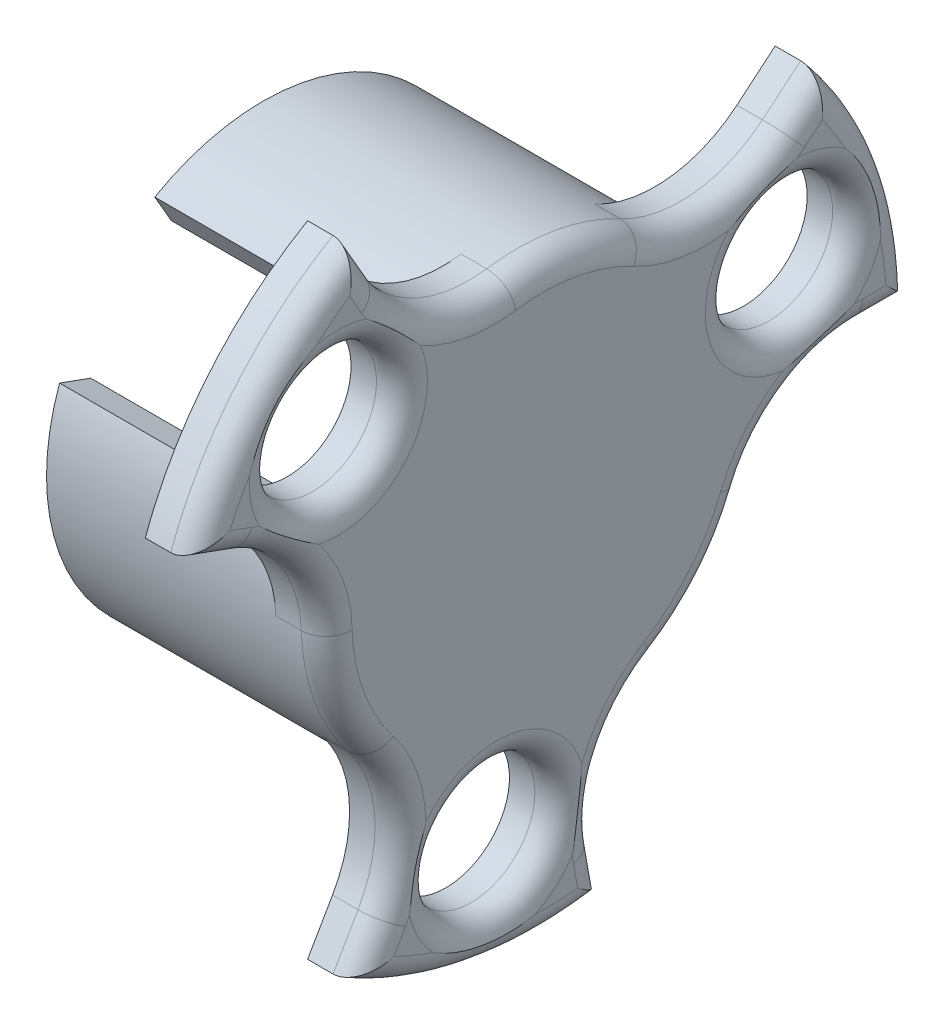
from build123d import *

# Parameters (mm, degrees)
SKETCH1_R           = 8.5
BOSS_EXTRUDE1_DEPTH = 1
SKETCH2_R           = 5.375
BOSS_EXTRUDE2_DEPTH = 1.5
BOSS_EXTRUDE2_TAPER = 40.000000000000085
BOSS_EXTRUDE3_START = 10
SKETCH3_R           = 8.5
SKETCH3_R_2         = 7.200000000000001
BOSS_EXTRUDE3_DEPTH = 10
CUT_REVOLVE1_ANGLE  = 40.000000000000085
CIRPATTERN1_COUNT   = 3
REVOLVE1_ANGLE      = 40.000000000000085
SKETCH9_R           = 2.5000000000000004
CUT_EXTRUDE1_DEPTH  = 10
CIRPATTERN3_COUNT   = 3
FILLET3_R           = 5
FILLET4_R           = 1


with BuildPart() as part:
    # Sketch1 → Boss-Extrude1 (new body)
    with BuildSketch(Plane(origin=(0, 0, 0), x_dir=(0, 0, -1), z_dir=(1, 0, 0))):
        Circle(SKETCH1_R)
    extrude(amount=BOSS_EXTRUDE1_DEPTH)

    # Sketch2 → Boss-Extrude2 (add)
    with BuildSketch(Plane.ZY):
        Circle(SKETCH2_R)
    extrude(amount=BOSS_EXTRUDE2_DEPTH, taper=BOSS_EXTRUDE2_TAPER)

    # Sketch3 → Boss-Extrude3 (add)
    with BuildSketch(Plane.ZY.offset(BOSS_EXTRUDE3_START)):
        Circle(SKETCH3_R)
        Circle(SKETCH3_R_2, mode=Mode.SUBTRACT)
    extrude(amount=-BOSS_EXTRUDE3_DEPTH)

    # Sketch6 → Cut-Revolve1 (revolve, cut)
    with BuildSketch(Plane(origin=(0, 0, 0), x_dir=(1, 0, 0), z_dir=(0, 1, 0))):
        Polygon((-9.999999999999998, 8.5), (-10, 7.200000000000001), (-0.9999999999999991, 7.200000000000001), (-0.9999999999999991, 8.5), align=None)
    cut_revolve1 = revolve(axis=Axis((-10, 0, 0), (1, 0, 0)), revolution_arc=CUT_REVOLVE1_ANGLE, mode=Mode.SUBTRACT)

    # CirPattern1: Cut-Revolve1 ×3 about axis
    cirpattern1_axis = Axis((0, 0, 0), (1, 0, 0))
    for i in range(1, CIRPATTERN1_COUNT):
        add(cut_revolve1.rotate(cirpattern1_axis, i * 360 / CIRPATTERN1_COUNT), mode=Mode.SUBTRACT)

    # Sketch8 → Revolve1 (revolve)
    with BuildSketch(Plane(origin=(0, 0, 0), x_dir=(1, 0, 0), z_dir=(0, 1, 0))):
        Polygon((-0.9999999999999996, 8.5), (1, 8.5), (0.9999999999999996, 14.5), (-0.9999999999999996, 14.5), align=None)
    revolve1 = revolve(axis=Axis((-10, 0, 0), (1, 0, 0)), revolution_arc=REVOLVE1_ANGLE)

    # Sketch9 → Cut-Extrude1 (cut)
    with BuildSketch(Plane.ZY.offset(0.9999999999999991)):
        with Locations((-9.866772518252038, 3.5912115049195292)):
            Circle(SKETCH9_R)
    cut_extrude1 = extrude(amount=-CUT_EXTRUDE1_DEPTH, mode=Mode.SUBTRACT)

    # CirPattern3: Revolve1, Cut-Extrude1 ×3 about axis
    cirpattern3_axis = Axis((0, -1.1e-16, 1.8e-16), (1, 0, 0))
    add([revolve1.rotate(cirpattern3_axis, i * 360 / CIRPATTERN3_COUNT) for i in range(1, CIRPATTERN3_COUNT)])
    add([cut_extrude1.rotate(cirpattern3_axis, i * 360 / CIRPATTERN3_COUNT) for i in range(1, CIRPATTERN3_COUNT)], mode=Mode.SUBTRACT)

    # Fillet3
    fillet3_edges = [part.edges().sort_by_distance(p)[0] for p in [
        (4.4e-16, 0, -8.5),
        (4.4e-16, 5.463694682335594, -6.511377766511305),
        (2.2e-16, -7.361215932167726, 4.2500000000000036),
        (2.2e-16, -8.370865900603766, -1.4760095101689152),
        (2.2e-16, 7.361215932167729, 4.249999999999998),
        (2.2e-16, 2.907171218268174, 7.987387276680224),
    ]]
    fillet(fillet3_edges, radius=FILLET3_R)

    # Fillet4
    # the kernel refuses this fillet: 1 mm, written as the material it takes off along each edge
    with BuildSketch(Plane(origin=(1, -10.340481406628186, 1.8233058655027679), x_dir=(0, 0.8660254037844382, -0.5000000000000006), z_dir=(0, 0.5000000000000006, 0.8660254037844382))) as fillet4_piece_1:
        with BuildLine():
            CenterArc((2.4999999999999996 + FILLET4_R, FILLET4_R), FILLET4_R, 180, 90)
            Line((2.4999999999999996, FILLET4_R), (2.4999999999999996, 0))
            Line((2.4999999999999996, 0), (2.4999999999999996 + FILLET4_R, 0))
        make_face()
    revolve(axis=Axis((1, -10.340481406628186, 1.8233058655027679), (-1, 0, 0)), mode=Mode.SUBTRACT)
    with BuildSketch(Plane(origin=(1, 6.74926990170866, 8.043466652749274), x_dir=(0, -0.8660254037844387, -0.4999999999999999), z_dir=(0, 0.4999999999999999, -0.8660254037844387))) as fillet4_piece_2:
        with BuildLine():
            CenterArc((2.5000000000000004 + FILLET4_R, FILLET4_R), FILLET4_R, 180, 90)
            Line((2.5000000000000004, FILLET4_R), (2.5000000000000004, 0))
            Line((2.5000000000000004, 0), (2.5000000000000004 + FILLET4_R, 0))
        make_face()
    revolve(axis=Axis((1, 6.74926990170866, 8.043466652749274), (-1, 0, 0)), mode=Mode.SUBTRACT)
    with BuildSketch(Plane(origin=(1, 0, 0), x_dir=(0, -0.030337209344300137, 0.9995397209361918), z_dir=(0, 0.9995397209361918, 0.030337209344300137))) as fillet4_piece_3:
        with BuildLine():
            CenterArc((8.5 - FILLET4_R, -FILLET4_R), FILLET4_R, 6.36e-15, 90)
            Line((8.5, -FILLET4_R), (8.5, 0))
            Line((8.5, 0), (8.5 - FILLET4_R, 0))
        make_face()
    revolve(axis=Axis((1, 0, 0), (1, 0, 0)), revolution_arc=36.52307841695891, mode=Mode.SUBTRACT)
    with BuildSketch(Plane(origin=(0.9999999999999997, -10.859903314486736, 6.269968101992234), x_dir=(0, -0.5000000000000006, -0.8660254037844385), z_dir=(0, -0.8660254037844384, 0.5000000000000004))) as fillet4_piece_4:
        with BuildLine():
            CenterArc((FILLET4_R, -FILLET4_R), FILLET4_R, 89.99999999999999, 90.00000000000001)
            Line((-3.3e-16, -FILLET4_R), (0, 0))
            Line((0, 0), (FILLET4_R, 0))
        make_face()
    extrude(amount=4.460063796015542, mode=Mode.SUBTRACT)
    with BuildSketch(Plane(origin=(0.9999999999999997, -12.349426395962368, -2.1775370698814775), x_dir=(0, -0.17364817766693136, 0.9848077530122079), z_dir=(0, -0.9848077530122079, -0.17364817766693136))) as fillet4_piece_5:
        with BuildLine():
            CenterArc((FILLET4_R, FILLET4_R), FILLET4_R, 180, 90)
            Line((-4.6e-16, FILLET4_R), (0, 0))
            Line((0, 0), (FILLET4_R, 0))
        make_face()
    extrude(amount=4.460063796015541, mode=Mode.SUBTRACT)
    with BuildSketch(Plane(origin=(1, 0, 0), x_dir=(0, -0.8504581857502006, -0.5260426544401863), z_dir=(0, -0.5260426544401863, 0.8504581857502006))) as fillet4_piece_6:
        with BuildLine():
            CenterArc((8.5 - FILLET4_R, -FILLET4_R), FILLET4_R, 0, 90)
            Line((8.5 - FILLET4_R, 0), (8.5, 0))
            Line((8.5, 0), (8.5, -FILLET4_R))
        make_face()
    revolve(axis=Axis((1, 0, 0), (1, 0, 0)), revolution_arc=36.52307841695894, mode=Mode.SUBTRACT)
    with BuildSketch(Plane(origin=(0.9999999999999997, 0, -12.539936203984453), x_dir=(3.3e-16, 1, 0), z_dir=(-7e-17, 0, -1))) as fillet4_piece_7:
        with BuildLine():
            CenterArc((FILLET4_R, -FILLET4_R), FILLET4_R, 89.99999999999999, 90.00000000000001)
            Line((-4.4e-16, -FILLET4_R), (0, 0))
            Line((0, 0), (FILLET4_R, 0))
        make_face()
    extrude(amount=4.460063796015547, mode=Mode.SUBTRACT)
    with BuildSketch(Plane(origin=(0.9999999999999997, 8.060515618180878, -9.60614844612877), x_dir=(0, -0.7660444431189771, -0.6427876096865406), z_dir=(0, 0.6427876096865406, -0.7660444431189771))) as fillet4_piece_8:
        with BuildLine():
            CenterArc((FILLET4_R, FILLET4_R), FILLET4_R, 180, 90)
            Line((-1.69e-15, FILLET4_R), (0, 0))
            Line((0, 0), (FILLET4_R, 0))
        make_face()
    extrude(amount=4.460063796015548, mode=Mode.SUBTRACT)
    with BuildSketch(Plane(origin=(1, 0, 0), x_dir=(0, 0.8807953950945009, -0.47349706649600487), z_dir=(0, -0.47349706649600487, -0.8807953950945009))) as fillet4_piece_9:
        with BuildLine():
            CenterArc((8.5 - FILLET4_R, -FILLET4_R), FILLET4_R, 6.36e-15, 90)
            Line((8.5, -FILLET4_R), (8.5, 0))
            Line((8.5, 0), (8.5 - FILLET4_R, 0))
        make_face()
    revolve(axis=Axis((1, 0, 0), (1, 0, 0)), revolution_arc=36.523078416958924, mode=Mode.SUBTRACT)
    with BuildSketch(Plane(origin=(0.9999999999999997, 4.28891077778149, 11.783685516010252), x_dir=(0, 0.9396926207859089, -0.3420201433256675), z_dir=(0, 0.3420201433256675, 0.9396926207859089))) as fillet4_piece_10:
        with BuildLine():
            CenterArc((FILLET4_R, FILLET4_R), FILLET4_R, 180, 90)
            Line((-3.3e-16, FILLET4_R), (0, 0))
            Line((0, 0), (FILLET4_R, 0))
        make_face()
    extrude(amount=4.460063796015548, mode=Mode.SUBTRACT)
    with BuildSketch(Plane(origin=(0.9999999999999997, 10.85990331448674, 6.269968101992225), x_dir=(0, -0.4999999999999998, 0.8660254037844388), z_dir=(0, 0.8660254037844388, 0.49999999999999983))) as fillet4_piece_11:
        with BuildLine():
            CenterArc((FILLET4_R, -FILLET4_R), FILLET4_R, 89.99999999999999, 90.00000000000001)
            Line((-3.3e-16, -FILLET4_R), (0, 0))
            Line((0, 0), (FILLET4_R, 0))
        make_face()
    extrude(amount=4.460063796015545, mode=Mode.SUBTRACT)
    with BuildSketch(Plane(origin=(1, -8.359903314486731, 10.600095120914425), x_dir=(0, 0.6192520973693878, -0.785192231178846), z_dir=(0, 0.785192231178846, 0.6192520973693878))) as fillet4_piece_12:
        with BuildLine():
            CenterArc((5 + FILLET4_R, FILLET4_R), FILLET4_R, 180, 90)
            Line((5.000000000000001, FILLET4_R), (5, 0))
            Line((5, 0), (5 + FILLET4_R, 0))
        make_face()
    revolve(axis=Axis((1, -8.359903314486731, 10.600095120914425), (-1, 0, 0)), revolution_arc=68.26153920847956, mode=Mode.SUBTRACT)
    with BuildSketch(Plane(origin=(1, -11.481185507627709, -7.101575834942517), x_dir=(0, 0.8504581857502005, 0.5260426544401863), z_dir=(0, 0.5260426544401863, -0.8504581857502005))) as fillet4_piece_13:
        with BuildLine():
            CenterArc((4.999999999999999 + FILLET4_R, -FILLET4_R), FILLET4_R, 90, 90)
            Line((4.999999999999999, -FILLET4_R), (4.999999999999999, 0))
            Line((4.999999999999999, 0), (4.999999999999999 + FILLET4_R, 0))
        make_face()
    revolve(axis=Axis((1, -11.481185507627709, -7.101575834942517), (1, 0, 0)), revolution_arc=68.26153920847953, mode=Mode.SUBTRACT)
    with BuildSketch(Plane(origin=(1, -5, -12.539936203984453), x_dir=(0, 0.3703703703703699, 0.9288841632581077), z_dir=(0, -0.9288841632581077, 0.3703703703703699))) as fillet4_piece_14:
        with BuildLine():
            CenterArc((4.999999999999999 + FILLET4_R, FILLET4_R), FILLET4_R, 180, 90)
            Line((4.999999999999999, FILLET4_R), (4.999999999999999, 0))
            Line((4.999999999999999, 0), (4.999999999999999 + FILLET4_R, 0))
        make_face()
    revolve(axis=Axis((1, -5, -12.539936203984453), (-1, 0, 0)), revolution_arc=68.26153920847953, mode=Mode.SUBTRACT)
    with BuildSketch(Plane(origin=(1, 11.890737833775763, -6.392210397696068), x_dir=(0, -0.8807953950945008, 0.4734970664960053), z_dir=(0, 0.4734970664960053, 0.8807953950945008))) as fillet4_piece_15:
        with BuildLine():
            CenterArc((5 + FILLET4_R, -FILLET4_R), FILLET4_R, 90, 90)
            Line((5, -FILLET4_R), (5, 0))
            Line((5, 0), (5 + FILLET4_R, 0))
        make_face()
    revolve(axis=Axis((1, 11.890737833775763, -6.392210397696068), (1, 0, 0)), revolution_arc=68.26153920847949, mode=Mode.SUBTRACT)
    with BuildSketch(Plane(origin=(1, -0.4095523261480558, 13.49378623263859), x_dir=(0, 0.9396926207859089, -0.34202014332566755), z_dir=(0, 0.34202014332566755, 0.9396926207859089))) as fillet4_piece_16:
        with BuildLine():
            CenterArc((5.000000000000001 + FILLET4_R, FILLET4_R), FILLET4_R, 180, 90)
            Line((5.000000000000001, FILLET4_R), (5.000000000000001, 0))
            Line((5.000000000000001, 0), (5.000000000000001 + FILLET4_R, 0))
        make_face()
    revolve(axis=Axis((1, -0.4095523261480558, 13.49378623263859), (-1, 0, 0)), revolution_arc=68.26153920847946, mode=Mode.SUBTRACT)
    with BuildSketch(Plane(origin=(1, 13.35990331448674, 1.9398410830700303), x_dir=(0, -0.9896224677397581, -0.14369193207926176), z_dir=(0, 0.14369193207926176, -0.9896224677397581))) as fillet4_piece_17:
        with BuildLine():
            CenterArc((5 + FILLET4_R, FILLET4_R), FILLET4_R, 180, 90)
            Line((5, FILLET4_R), (5, 0))
            Line((5, 0), (5 + FILLET4_R, 0))
        make_face()
    revolve(axis=Axis((1, 13.35990331448674, 1.9398410830700303), (-1, 0, 0)), revolution_arc=68.26153920847953, mode=Mode.SUBTRACT)
    with BuildSketch(Plane(origin=(1, 0, 0), x_dir=(0, -0.17157432670393416, -0.9851711782305101), z_dir=(0, -0.9851711782305101, 0.17157432670393416))) as fillet4_piece_18:
        with BuildLine():
            CenterArc((14.5 - FILLET4_R, -FILLET4_R), FILLET4_R, 6.36e-15, 90)
            Line((14.5, -FILLET4_R), (14.5, 0))
            Line((14.5, 0), (14.5 - FILLET4_R, 0))
        make_face()
    revolve(axis=Axis((1, 0, 0), (1, 0, 0)), revolution_arc=59.75873272198037, mode=Mode.SUBTRACT)
    with BuildSketch(Plane(origin=(1, 3.5912115049195292, -9.866772518252038), x_dir=(0, 0, 1), z_dir=(0, -1, 0))) as fillet4_piece_19:
        with BuildLine():
            CenterArc((2.5 + FILLET4_R, FILLET4_R), FILLET4_R, 180, 90)
            Line((2.5, FILLET4_R), (2.5, 0))
            Line((2.5, 0), (2.5 + FILLET4_R, 0))
        make_face()
    revolve(axis=Axis((1, 3.5912115049195292, -9.866772518252038), (-1, 0, 0)), mode=Mode.SUBTRACT)
    with BuildSketch(Plane(origin=(1, -3.2e-16, 1.8e-16), x_dir=(0, -0.7673961040719015, 0.6411733146780733), z_dir=(0, 0.6411733146780733, 0.7673961040719015))) as fillet4_piece_20:
        with BuildLine():
            CenterArc((14.500000000000002 - FILLET4_R, -FILLET4_R), FILLET4_R, 1.272e-14, 90)
            Line((14.500000000000002, -FILLET4_R), (14.500000000000002, 0))
            Line((14.500000000000002, 0), (14.500000000000002 - FILLET4_R, 0))
        make_face()
    revolve(axis=Axis((1, -3.2e-16, 1.8e-16), (1, 0, 0)), revolution_arc=59.75873272198037, mode=Mode.SUBTRACT)
    with BuildSketch(Plane(origin=(1, 0, 3.7e-16), x_dir=(0, 0.938970430775836, 0.3439978635524371), z_dir=(0, 0.3439978635524371, -0.938970430775836))) as fillet4_piece_21:
        with BuildLine():
            CenterArc((14.500000000000002 - FILLET4_R, -FILLET4_R), FILLET4_R, 6.36e-15, 90)
            Line((14.500000000000004, -FILLET4_R), (14.500000000000002, 0))
            Line((14.500000000000002, 0), (14.500000000000002 - FILLET4_R, 0))
        make_face()
    revolve(axis=Axis((1, 0, 3.7e-16), (1, 0, 0)), revolution_arc=59.75873272198037, mode=Mode.SUBTRACT)


solid = part.part
